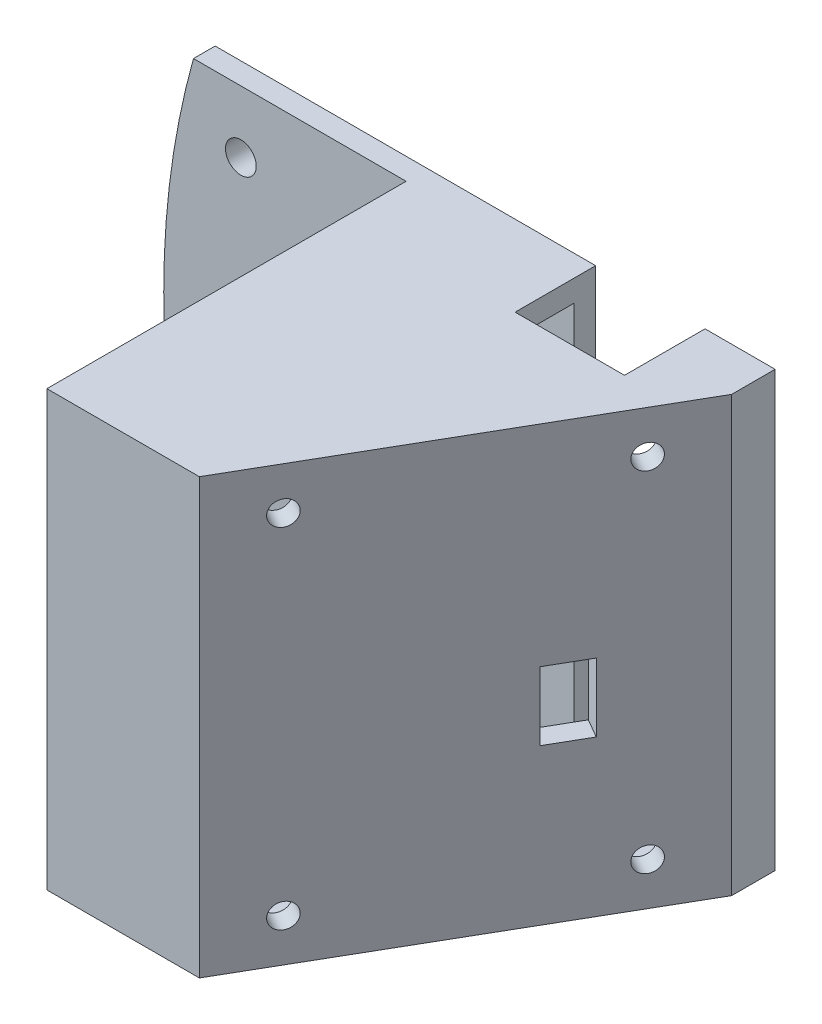
from build123d import *

# Parameters (mm, degrees)
BOSS_EXTRUDE5_DEPTH            = 31.75
BOSS_EXTRUDE5_DEPTH_BACK       = 31.75
SKETCH1_R                      = 2.2479
BOSS_EXTRUDE6_DEPTH            = 3.175
SHELL2_START                   = -28.575
SHELL2_DEPTH                   = 57.15
F_1_0MM_DOWEL_HOLE1_AT_2_COUNT = 2
F_1_0MM_DOWEL_HOLE1_AT_2_PITCH = 51
F_1_0MM_DOWEL_HOLE1_AT_3_COUNT = 2
F_1_0MM_DOWEL_HOLE1_AT_3_PITCH = 64.202803677
F_1_0MM_DOWEL_HOLE1_AT_4_COUNT = 2
F_1_0MM_DOWEL_HOLE1_AT_4_PITCH = 39
SKETCH9_W                      = 16
SKETCH9_H                      = 9.25
SKETCH9_H_2                    = 2.52847891
CUT_EXTRUDE1_DEPTH             = 146.121062048
SKETCH10_W                     = 6
SKETCH10_H                     = 10
CUT_EXTRUDE2_DEPTH             = 3.175


# Read off the part's stored shape, not the designer's step: Shell2
with BuildPart() as part:
    # Sketch5 → Boss-Extrude5 (new, two sides: drawn at the far end of the back side and taken through both)
    with BuildSketch(Plane(origin=(0, 0, 0), x_dir=(1, 0, 0), z_dir=(0, 1, 0)).offset(-BOSS_EXTRUDE5_DEPTH_BACK)):
        Polygon((-31.75, 0), (-31.75, -6.35), (-60.25, -55.713448016), (-82.55, -55.713448016), (-82.55, 0), align=None)
    extrude(amount=BOSS_EXTRUDE5_DEPTH + BOSS_EXTRUDE5_DEPTH_BACK)

    # Sketch1 → Boss-Extrude6 (add)
    with BuildSketch(Plane.XY):
        with BuildLine():
            Line((-31.75, 31.75), (-113.647797428, 31.75))
            ThreePointArc((-113.647797428, 31.75), (-117.99951, 0), (-113.647797428, -31.75))
            Line((-113.647797428, -31.75), (-31.75, -31.75))
            Line((-31.75, -31.75), (-31.75, 31.75))
        make_face()
        with Locations((-106.71590324, -22.683165468)):
            Circle(SKETCH1_R, mode=Mode.SUBTRACT)
        with Locations((-109.1, 0)):
            Circle(SKETCH1_R, mode=Mode.SUBTRACT)
        with Locations((-106.71590324, 22.683165468)):
            Circle(SKETCH1_R, mode=Mode.SUBTRACT)
    extrude(amount=BOSS_EXTRUDE6_DEPTH)

    # Shell2 outline → Shell2 (cut)
    with BuildSketch(Plane(origin=(0, 0, 0), x_dir=(1, 0, 0), z_dir=(0, 1, 0)).offset(SHELL2_START)):
        Polygon((-34.925, -3.175), (-82.55, -3.175), (-82.55, -52.538448016), (-62.083087105, -52.538448016), (-34.925, -5.499261314), align=None)
    extrude(amount=SHELL2_DEPTH, mode=Mode.SUBTRACT)

    # Sketch8 → Ø1.0mm Dowel Hole1 (revolve, cut)
    with BuildSketch(Plane(origin=(-55.75, -25.5, 47.919219382), x_dir=(0.4999999999999977, 0, -0.86602540378444), z_dir=(0, 1, 0))):
        Polygon((0, 0), (0, 4.256549114), (1.8, 3.175), (1.8, 0), align=None)
    f_1_0mm_dowel_hole1 = revolve(axis=Axis((-50.250738686, -25.5, 51.094219382), (-0.86602540378444, 0, -0.4999999999999977)), mode=Mode.SUBTRACT)

    # Ø1.0mm Dowel Hole1 at 2: Ø1.0mm Dowel Hole1 ×2
    with Locations(*[(0, i * F_1_0MM_DOWEL_HOLE1_AT_2_PITCH, 0) for i in range(1, F_1_0MM_DOWEL_HOLE1_AT_2_COUNT)]):
        add(f_1_0mm_dowel_hole1, mode=Mode.SUBTRACT)

    # Ø1.0mm Dowel Hole1 at 3: Ø1.0mm Dowel Hole1 ×2
    with Locations(*[Vector(0.3037250537853972, 0.7943578329771961, -0.5260672246879011) * (i * F_1_0MM_DOWEL_HOLE1_AT_3_PITCH) for i in range(1, F_1_0MM_DOWEL_HOLE1_AT_3_COUNT)]):
        add(f_1_0mm_dowel_hole1, mode=Mode.SUBTRACT)

    # Ø1.0mm Dowel Hole1 at 4: Ø1.0mm Dowel Hole1 ×2
    with Locations(*[Vector(0.49999999999999767, 0, -0.86602540378444) * (i * F_1_0MM_DOWEL_HOLE1_AT_4_PITCH) for i in range(1, F_1_0MM_DOWEL_HOLE1_AT_4_COUNT)]):
        add(f_1_0mm_dowel_hole1, mode=Mode.SUBTRACT)

    # Sketch9 → Cut-Extrude1 (cut, through all)
    with BuildSketch(Plane.XZ.offset(31.75)):
        with Locations((-50, 4.625)):
            Rectangle(SKETCH9_W, SKETCH9_H)
        with Locations((-50, 10.514239455)):
            Rectangle(SKETCH9_W, SKETCH9_H_2)
    extrude(amount=-CUT_EXTRUDE1_DEPTH, mode=Mode.SUBTRACT)

    # Sketch10 → Cut-Extrude2 (cut)
    with BuildSketch(Plane(origin=(-21.062869343, 0, -12.160653285), x_dir=(-0.4999999999999977, 0, 0.8660254037844399), z_dir=(-0.8660254037844399, 0, -0.4999999999999977))):
        with Locations((38.874261314, -4)):
            Rectangle(SKETCH10_W, SKETCH10_H)
    extrude(amount=CUT_EXTRUDE2_DEPTH, mode=Mode.SUBTRACT)


solid = part.part
